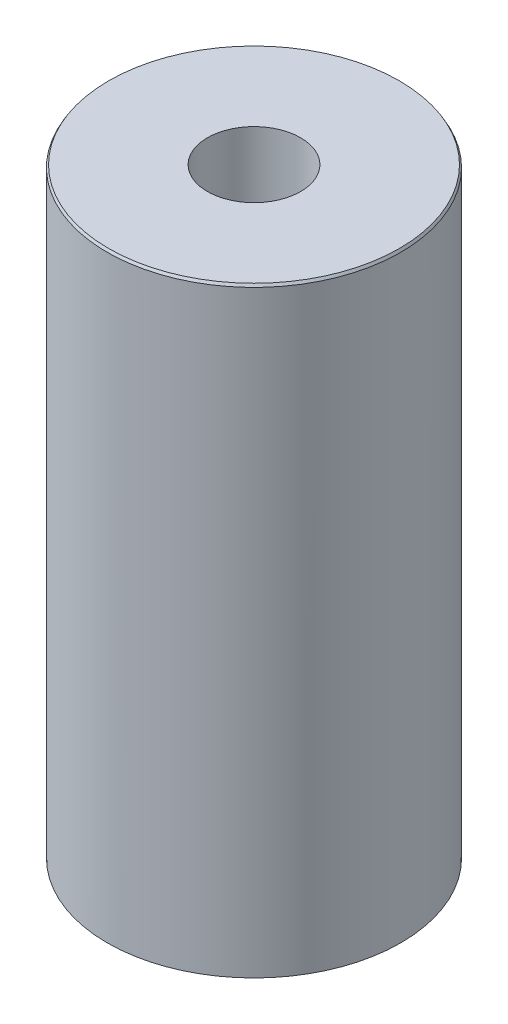
from build123d import *
from OCP.BRepFilletAPI import BRepFilletAPI_MakeChamfer

# Parameters (mm, degrees)
SKETCH1_R           = 57.5
BOSS_EXTRUDE1_DEPTH = 235.873118486
SKETCH2_R           = 18.265529327
CUT_EXTRUDE1_DEPTH  = 250.496749526
CHAMFER1_SIZE       = 0.997450877
CHAMFER1_SIZE2      = 0.575878532


with BuildPart() as part:
    # Sketch1 → Boss-Extrude1 (new body)
    with BuildSketch(Plane(origin=(0, 0, 0), x_dir=(1, 0, 0), z_dir=(0, 1, 0))):
        Circle(SKETCH1_R)
    extrude(amount=BOSS_EXTRUDE1_DEPTH)

    # Sketch2 → Cut-Extrude1 (cut, through all)
    with BuildSketch(Plane(origin=(0, 0, 0), x_dir=(1, 0, 0), z_dir=(0, 1, 0))):
        Circle(SKETCH2_R)
    extrude(amount=CUT_EXTRUDE1_DEPTH, mode=Mode.SUBTRACT)

    # Chamfer1: one chamfer whose edges measure the first distance from different faces: ONE call of the kernel's chamfer builder (chamfer() names one face for all edges)
    chamfer1_edges_1 = [part.edges().sort_by_distance(p)[0] for p in [
        (-57.5, 235.873118486, 0),
    ]]
    chamfer1_side_1 = [part.faces().sort_by_distance(p)[0] for p in [
        (-57.5, 117.936559243, 0),
    ]]
    chamfer1_edges_2 = [part.edges().sort_by_distance(p)[0] for p in [
        (-57.5, 0, 0),
    ]]
    chamfer1_side_2 = [part.faces().sort_by_distance(p)[0] for p in [
        (-55.873654403, 0, 0),
    ]]
    chamfer1 = BRepFilletAPI_MakeChamfer(part.part.solid().wrapped)
    for e in chamfer1_edges_1:
        chamfer1.Add(CHAMFER1_SIZE, CHAMFER1_SIZE2, e.wrapped, chamfer1_side_1[0].wrapped)  # the first distance lies on this face
    for e in chamfer1_edges_2:
        chamfer1.Add(CHAMFER1_SIZE, CHAMFER1_SIZE2, e.wrapped, chamfer1_side_2[0].wrapped)  # the first distance lies on this face
    add(Compound.cast(chamfer1.Shape()), mode=Mode.REPLACE)


solid = part.part
